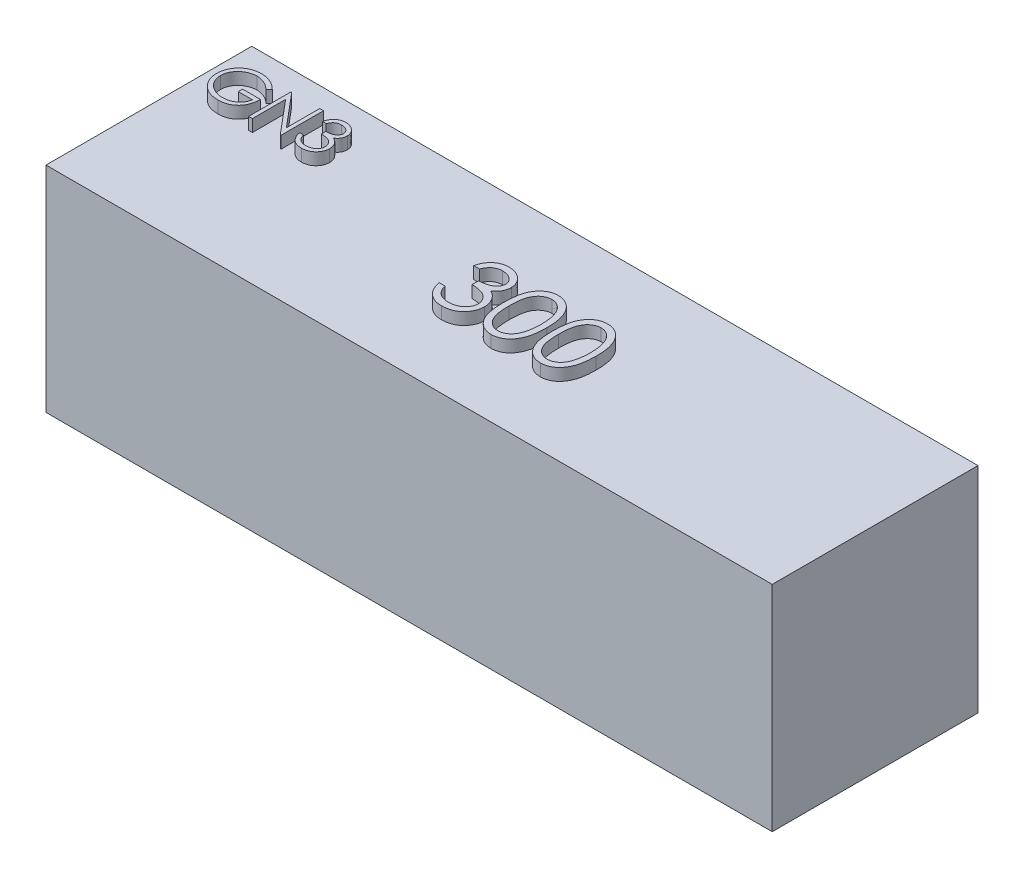
from build123d import *

# Parameters (mm, degrees)
SKETCH5_W           = 60
SKETCH5_H           = 17.7
BOSS_EXTRUDE2_DEPTH = 17
BOSS_EXTRUDE3_DEPTH = 1


with BuildPart() as part:
    # Sketch5 → Boss-Extrude2 (new body)
    with BuildSketch(Plane.XY):
        with Locations((30, 8.85)):
            Rectangle(SKETCH5_W, SKETCH5_H)
    extrude(amount=BOSS_EXTRUDE2_DEPTH)

    # Sketch6 → Boss-Extrude3 (add)
    # profile 1 of 6: a face of its own
    with BuildSketch(Plane(origin=(0, 17.7, 0), x_dir=(1, 0, 0), z_dir=(0, 1, 0))):
        with BuildLine():
            Line((4.942496515, -3.246050022), (4.673265746, -3.501258356))
            add(Edge.make_bspline(
                [(4.673265746, -3.501258356), (4.624546858, -3.455427493), (4.528270811, -3.36485863), (4.371310569, -3.247347635), (4.207546935, -3.146681534), (4.037834438, -3.064775298), (3.866375884, -2.999422537), (3.695447107, -2.952894397), (3.526801406, -2.92322186), (3.414634188, -2.91967349), (3.359363502, -2.917925022)],
                knots=[0, 0, 0, 0, 1.08915593, 2.152340314, 3.188132944, 4.216796309, 5.218260357, 6.173443236, 7.099959455, 8, 8, 8, 8], degree=3))
            add(Edge.make_bspline(
                [(3.359363502, -2.917925022), (3.325448802, -2.918338628), (3.257707362, -2.919164767), (3.157085418, -2.929708983), (3.057518781, -2.944873847), (2.959195406, -2.966815724), (2.86192412, -2.994624784), (2.766043227, -3.029410247), (2.671373873, -3.069965491), (2.578807792, -3.116827965), (2.489067288, -3.168307811), (2.404310452, -3.225356352), (2.323997053, -3.286145142), (2.249636628, -3.352196121), (2.180801441, -3.422910987), (2.11585307, -3.496974293), (2.057075774, -3.576409511), (2.003984609, -3.659755137), (1.95662299, -3.745547327), (1.914814337, -3.832960316), (1.879717249, -3.921704171), (1.851947793, -4.011890248), (1.829037139, -4.102820838), (1.812919532, -4.195125559), (1.80383281, -4.288903244), (1.80226103, -4.351700503), (1.801470874, -4.383269574)],
                knots=[0, 0, 0, 0, 1.02818874, 2.053710826, 3.065248034, 4.081641283, 5.106893873, 6.131558223, 7.173050175, 8.228653731, 9.27666206, 10.308777013, 11.325269123, 12.329503258, 13.32196095, 14.316845687, 15.314881793, 16.315733098, 17.311955233, 18.285320748, 19.252783886, 20.203351036, 21.145449891, 22.095197417, 23.042428769, 24, 24, 24, 24], degree=3))
            add(Edge.make_bspline(
                [(1.801470874, -4.383269574), (1.802226592, -4.415540391), (1.803735965, -4.479993904), (1.813396285, -4.576187977), (1.831324525, -4.670953379), (1.855292234, -4.764601512), (1.88527305, -4.85729276), (1.922645716, -4.94862527), (1.966911316, -5.038595661), (2.018147868, -5.126393278), (2.074334072, -5.211916302), (2.137277153, -5.292475824), (2.204137736, -5.369144601), (2.277351636, -5.440220365), (2.354571178, -5.507604261), (2.438103454, -5.569439783), (2.526305915, -5.626918006), (2.619313127, -5.679314525), (2.716115909, -5.726123061), (2.815372662, -5.767746957), (2.917400478, -5.802026295), (3.021663168, -5.829964399), (3.128036439, -5.852864696), (3.237060242, -5.867597176), (3.34793295, -5.878288007), (3.422671582, -5.879069677), (3.460325041, -5.879463484)],
                knots=[0, 0, 0, 0, 0.93586088, 1.869166235, 2.799637598, 3.729985548, 4.670839027, 5.622275134, 6.589130586, 7.576015415, 8.568469353, 9.55398029, 10.53834874, 11.515998671, 12.510579167, 13.508179873, 14.527009472, 15.561807829, 16.601455013, 17.643573243, 18.680854198, 19.719860599, 20.772568776, 21.833555941, 22.908541556, 24, 24, 24, 24], degree=3))
            add(Edge.make_bspline(
                [(3.460325041, -5.879463484), (3.505703388, -5.878514908), (3.594811145, -5.876652224), (3.725797588, -5.862151934), (3.851600659, -5.839505141), (3.971866862, -5.806339244), (4.086735883, -5.764035569), (4.196628824, -5.713040183), (4.300680483, -5.651397124), (4.399203656, -5.581823256), (4.489960842, -5.504308424), (4.571814966, -5.420663969), (4.643460455, -5.331295902), (4.705965154, -5.236730587), (4.757673809, -5.136185282), (4.800116604, -5.030152719), (4.832649895, -4.918585207), (4.84600487, -4.841493576), (4.852752925, -4.802540407)],
                knots=[0, 0, 0, 0, 1.13008108, 2.219097802, 3.278683437, 4.311054135, 5.322181354, 6.324827112, 7.324222904, 8.330512327, 9.32562643, 10.293043162, 11.24128371, 12.174520618, 13.111833804, 14.052305215, 15.015860969, 16, 16, 16, 16], degree=3))
            Line((4.852752925, -4.802540407), (3.686086259, -4.802540407))
            Line((3.686086259, -4.802540407), (3.686086259, -4.443566048))
            Line((3.686086259, -4.443566048), (5.166855489, -4.443566048))
            add(Edge.make_bspline(
                [(5.166855489, -4.443566048), (5.165149641, -4.510473537), (5.161810988, -4.641423579), (5.138392072, -4.832393849), (5.10057556, -5.012765543), (5.048915248, -5.182728614), (4.982039968, -5.342042207), (4.900667439, -5.490868073), (4.803495318, -5.628244754), (4.693984877, -5.755293758), (4.571084919, -5.86862297), (4.438116299, -5.968228908), (4.29485933, -6.052131523), (4.141449523, -6.120392186), (3.978389089, -6.173666181), (3.80530071, -6.211437757), (3.622419109, -6.234067721), (3.497082432, -6.2369591), (3.432981291, -6.238437843)],
                knots=[0, 0, 0, 0, 1.140356446, 2.231883559, 3.274166699, 4.278491846, 5.25512956, 6.21435461, 7.1637429, 8.11826594, 9.068280886, 10.0076534, 10.945064095, 11.891975133, 12.864533718, 13.863980011, 14.907571808, 16, 16, 16, 16], degree=3))
            add(Edge.make_bspline(
                [(3.432981291, -6.238437843), (3.393471155, -6.237868722), (3.315544434, -6.236746231), (3.200453506, -6.228768884), (3.088535886, -6.216488307), (2.979807877, -6.197943184), (2.873869535, -6.17522853), (2.77124995, -6.146141811), (2.671558208, -6.112473112), (2.574640222, -6.074177438), (2.481375675, -6.029805781), (2.391349158, -5.980496142), (2.304063033, -5.926502781), (2.220111868, -5.866891936), (2.139058246, -5.802109475), (2.061424803, -5.732025556), (1.986776925, -5.656854437), (1.940016461, -5.603475427), (1.916454848, -5.576578868)],
                knots=[0, 0, 0, 0, 1.107784379, 2.184907829, 3.233506516, 4.263428166, 5.276301166, 6.270063455, 7.25232949, 8.225834625, 9.190232166, 10.146266622, 11.1027726, 12.066435141, 13.031522626, 14.010570082, 14.99756817, 16, 16, 16, 16], degree=3))
            add(Edge.make_bspline(
                [(1.916454848, -5.576578868), (1.882268916, -5.533908215), (1.814464504, -5.449275198), (1.727186347, -5.313675254), (1.652784944, -5.173273394), (1.592417122, -5.027678765), (1.545279036, -4.877027553), (1.511472783, -4.721512261), (1.491665494, -4.560932631), (1.488811957, -4.452267366), (1.48736831, -4.39729201)],
                knots=[0, 0, 0, 0, 1.023165419, 2.029347347, 3.013907458, 3.994755782, 4.975994455, 5.96558838, 6.970761222, 8, 8, 8, 8], degree=3))
            add(Edge.make_bspline(
                [(1.48736831, -4.39729201), (1.487900548, -4.356125757), (1.48895826, -4.274316449), (1.501783776, -4.152859142), (1.520185194, -4.03355845), (1.547232249, -3.916511893), (1.581328513, -3.801641302), (1.623881999, -3.688893338), (1.673426895, -3.578201466), (1.731012392, -3.470327598), (1.795096851, -3.366703185), (1.864647071, -3.267745382), (1.940650672, -3.175256317), (2.021866471, -3.088064669), (2.109263461, -3.007265822), (2.202022885, -2.932111711), (2.300216228, -2.862501525), (2.404152408, -2.799531691), (2.512280092, -2.74296807), (2.624340094, -2.693378858), (2.740298205, -2.652395543), (2.859285682, -2.617621763), (2.982203183, -2.591906623), (3.10815872, -2.573257877), (3.237808832, -2.560497278), (3.325444861, -2.559471022), (3.369880329, -2.558950663)],
                knots=[0, 0, 0, 0, 1.008945113, 2.00506715, 2.99143336, 3.967273523, 4.948097931, 5.927297278, 6.919902385, 7.919676788, 8.923139349, 9.905703106, 10.883022732, 11.856032218, 12.825136022, 13.798837087, 14.781400844, 15.773989409, 16.776158564, 17.77167057, 18.775803737, 19.789618931, 20.80898985, 21.851988756, 22.910860228, 24, 24, 24, 24], degree=3))
            add(Edge.make_bspline(
                [(3.369880329, -2.558950663), (3.406118573, -2.559530155), (3.477974752, -2.560679219), (3.584900484, -2.568643867), (3.690173499, -2.581267748), (3.793949888, -2.598494535), (3.895876255, -2.621958225), (3.99624296, -2.65003651), (4.095195496, -2.682728333), (4.192423745, -2.721717179), (4.288581461, -2.765970804), (4.384203302, -2.815784226), (4.478962548, -2.872009231), (4.573023529, -2.934812766), (4.666979387, -3.003116184), (4.75934403, -3.078873008), (4.852346974, -3.159095764), (4.912148788, -3.216777948), (4.942496515, -3.246050022)],
                knots=[0, 0, 0, 0, 0.985871117, 1.954866573, 2.915460327, 3.869826059, 4.81536089, 5.759505086, 6.70452669, 7.649098992, 8.607881297, 9.583363685, 10.581137262, 11.603961102, 12.659522466, 13.73993555, 14.853081303, 16, 16, 16, 16], degree=3))
        make_face()
    # profile 2 of 6: a face of its own
    with BuildSketch(Plane(origin=(0, 17.7, 0), x_dir=(1, 0, 0), z_dir=(0, 1, 0))):
        Polygon((5.884804207, -6.148694253), (5.884804207, -2.648694253), (5.950709656, -2.648694253), (8.263009336, -5.403401785), (8.263009336, -2.648694253), (8.5771119, -2.648694253), (8.5771119, -6.148694253), (8.505597477, -6.148694253), (6.198906771, -3.400296817), (6.198906771, -6.148694253), align=None)
    # profile 3 of 6: a face of its own
    with BuildSketch(Plane(origin=(0, 17.7, 0), x_dir=(1, 0, 0), z_dir=(0, 1, 0))):
        with BuildLine():
            Line((9.609163182, -3.456386561), (9.295060618, -3.456386561))
            add(Edge.make_bspline(
                [(9.295060618, -3.456386561), (9.303570168, -3.421154077), (9.320205644, -3.352277452), (9.354903217, -3.253870192), (9.392702473, -3.16074667), (9.438091577, -3.074650596), (9.487600331, -2.993851694), (9.544323053, -2.920182569), (9.605642775, -2.851769604), (9.673467725, -2.791056366), (9.744596386, -2.736078637), (9.820031006, -2.68920358), (9.8982539, -2.648879427), (9.979807033, -2.615659195), (10.064933204, -2.590633671), (10.152862828, -2.572476866), (10.243826328, -2.560685752), (10.305573918, -2.559534988), (10.336927605, -2.558950663)],
                knots=[0, 0, 0, 0, 1.162005537, 2.271625781, 3.343758855, 4.383309926, 5.390229558, 6.379919256, 7.361854164, 8.333198761, 9.295911338, 10.242430842, 11.177959212, 12.116337295, 13.062827104, 14.020064771, 14.994644689, 16, 16, 16, 16], degree=3))
            add(Edge.make_bspline(
                [(10.336927605, -2.558950663), (10.382610347, -2.560329894), (10.472979358, -2.563058269), (10.605742405, -2.587972706), (10.733769224, -2.627397838), (10.855658472, -2.681871565), (10.968876904, -2.749058878), (11.069613091, -2.829023615), (11.156501602, -2.920222917), (11.22939598, -3.020955481), (11.286470979, -3.12861099), (11.328557352, -3.239411147), (11.354179033, -3.353093119), (11.35749959, -3.429850398), (11.359163182, -3.468305631)],
                knots=[0, 0, 0, 0, 1.083050992, 2.142477498, 3.193116406, 4.255571735, 5.30263384, 6.308962982, 7.297363603, 8.282367274, 9.249857812, 10.179914175, 11.08814088, 12, 12, 12, 12], degree=3))
            add(Edge.make_bspline(
                [(11.359163182, -3.468305631), (11.357999591, -3.505312426), (11.355722624, -3.57772898), (11.336388918, -3.683450478), (11.303852655, -3.783092078), (11.258782893, -3.87707324), (11.200441342, -3.96479808), (11.129768645, -4.046463971), (11.046265984, -4.122433129), (10.982987046, -4.165952602), (10.950409175, -4.188357715)],
                knots=[0, 0, 0, 0, 1.024540389, 2.004866551, 2.965041327, 3.920577974, 4.882998113, 5.874504559, 6.905732034, 8, 8, 8, 8], degree=3))
            add(Edge.make_bspline(
                [(10.950409175, -4.188357715), (10.98764093, -4.206335886), (11.061407804, -4.241955844), (11.161958334, -4.311811601), (11.253236209, -4.392467949), (11.304139928, -4.455410602), (11.329716066, -4.487035599)],
                knots=[0, 0, 0, 0, 1.015518401, 2.012035669, 3.001164323, 4, 4, 4, 4], degree=3))
            add(Edge.make_bspline(
                [(11.329716066, -4.487035599), (11.346557409, -4.510093351), (11.379964305, -4.555831267), (11.421199839, -4.629367693), (11.458608953, -4.703719183), (11.487759172, -4.780878589), (11.510333039, -4.859951602), (11.526469071, -4.941073998), (11.536493212, -5.024312021), (11.537928764, -5.080624501), (11.538650361, -5.108930631)],
                knots=[0, 0, 0, 0, 1.025084078, 2.033381695, 3.024893161, 4.013698104, 4.991890475, 5.976764909, 6.982997093, 8, 8, 8, 8], degree=3))
            add(Edge.make_bspline(
                [(11.538650361, -5.108930631), (11.536855848, -5.157940352), (11.533275266, -5.255729154), (11.501271191, -5.400203876), (11.451657951, -5.541429378), (11.381201015, -5.676504217), (11.295333506, -5.802884598), (11.193176182, -5.915960908), (11.075889773, -6.013159512), (10.945084124, -6.09436974), (10.803366996, -6.159287662), (10.651791404, -6.204345105), (10.49254135, -6.233691105), (10.383334052, -6.236837974), (10.327813021, -6.238437843)],
                knots=[0, 0, 0, 0, 0.955779014, 1.907060117, 2.875433937, 3.871313158, 4.872415639, 5.851225146, 6.836215519, 7.83643374, 8.849228613, 9.86973379, 10.916971861, 12, 12, 12, 12], degree=3))
            add(Edge.make_bspline(
                [(10.327813021, -6.238437843), (10.290393721, -6.23756963), (10.216765016, -6.235861275), (10.108521518, -6.224182674), (10.005199818, -6.202852669), (9.906660221, -6.174149364), (9.812815184, -6.137757622), (9.723951079, -6.092438924), (9.639521185, -6.039127421), (9.560322234, -5.977193834), (9.486363667, -5.907912494), (9.419610942, -5.830053484), (9.358951149, -5.74505608), (9.306008511, -5.651933024), (9.258371558, -5.551887767), (9.219190601, -5.443639268), (9.184705033, -5.328155246), (9.168671569, -5.247677506), (9.160445233, -5.206386561)],
                knots=[0, 0, 0, 0, 1.048658725, 2.063410685, 3.046034179, 4.001477787, 4.936774919, 5.862367409, 6.792675028, 7.730719943, 8.675894397, 9.627829632, 10.600096036, 11.597688215, 12.626045268, 13.701542398, 14.82072376, 16, 16, 16, 16], degree=3))
            Line((9.160445233, -5.206386561), (9.474547797, -5.206386561))
            add(Edge.make_bspline(
                [(9.474547797, -5.206386561), (9.482731089, -5.233335574), (9.498648301, -5.285753746), (9.525742599, -5.361194051), (9.556610871, -5.430352105), (9.58972543, -5.493735227), (9.624503876, -5.551967629), (9.663418801, -5.603509498), (9.703587946, -5.6506247), (9.7338673, -5.677169312), (9.748686419, -5.690160599)],
                knots=[0, 0, 0, 0, 1.198163088, 2.33053128, 3.407730985, 4.417276592, 5.372219308, 6.28897303, 7.162600585, 8, 8, 8, 8], degree=3))
            add(Edge.make_bspline(
                [(9.748686419, -5.690160599), (9.768282995, -5.705268933), (9.807415658, -5.735438965), (9.871183889, -5.773940593), (9.938248776, -5.807301619), (10.01006345, -5.832785315), (10.08507822, -5.854362975), (10.164505585, -5.868483494), (10.247644803, -5.878171666), (10.304412566, -5.879026597), (10.333421996, -5.879463484)],
                knots=[0, 0, 0, 0, 0.946170439, 1.889420265, 2.845303464, 3.807233317, 4.801018734, 5.828864929, 6.890507805, 8, 8, 8, 8], degree=3))
            add(Edge.make_bspline(
                [(10.333421996, -5.879463484), (10.366175498, -5.878847579), (10.430222145, -5.877643229), (10.523677005, -5.866567522), (10.612584452, -5.850437109), (10.695957378, -5.825524126), (10.774887885, -5.794743275), (10.848269535, -5.756094869), (10.917065641, -5.710750147), (10.980395047, -5.659210989), (11.037340554, -5.602789494), (11.087480067, -5.543776423), (11.130104729, -5.482420593), (11.164488307, -5.418382472), (11.191638857, -5.351927243), (11.210122058, -5.282868414), (11.222973573, -5.211771148), (11.224020185, -5.163442179), (11.224547797, -5.139078868)],
                knots=[0, 0, 0, 0, 1.217147791, 2.380027433, 3.494444702, 4.572153297, 5.609568379, 6.639424714, 7.649109417, 8.668170816, 9.669597737, 10.625200337, 11.543417969, 12.441394052, 13.322311151, 14.205496177, 15.095365482, 16, 16, 16, 16], degree=3))
            add(Edge.make_bspline(
                [(11.224547797, -5.139078868), (11.223017496, -5.10646753), (11.219964507, -5.041407121), (11.196655928, -4.945689547), (11.158317063, -4.853466135), (11.104644552, -4.766310345), (11.039308824, -4.685534443), (10.962943917, -4.613462961), (10.874915688, -4.553992869), (10.793895819, -4.512904213), (10.722130663, -4.484867138), (10.660715278, -4.466192173), (10.591958675, -4.450378518), (10.516692326, -4.435666246), (10.43434911, -4.423144898), (10.345018672, -4.412703082), (10.24868291, -4.404348041), (10.181991744, -4.400616946), (10.14762472, -4.398694253)],
                knots=[0, 0, 0, 0, 1.07054697, 2.135767047, 3.216561865, 4.33974944, 5.486079747, 6.621378074, 7.775625952, 8.963672916, 9.598146892, 10.304877434, 11.070270905, 11.915000392, 12.823868403, 13.805723172, 14.86925407, 16, 16, 16, 16], degree=3))
            Line((10.14762472, -4.398694253), (10.14762472, -4.039719894))
            add(Edge.make_bspline(
                [(10.14762472, -4.039719894), (10.190925886, -4.03898509), (10.275742232, -4.03754579), (10.399636537, -4.02013778), (10.518109849, -3.996057152), (10.628536591, -3.95917196), (10.729185305, -3.916331663), (10.816504907, -3.866479453), (10.889272054, -3.811064704), (10.947133126, -3.749232095), (10.990662354, -3.682917047), (11.022489152, -3.61380039), (11.041289478, -3.541276329), (11.043799145, -3.491781661), (11.045060618, -3.466903388)],
                knots=[0, 0, 0, 0, 1.321986639, 2.589447074, 3.816329219, 5.01088745, 6.139805852, 7.153945165, 8.075214402, 8.924034688, 9.728124013, 10.488707548, 11.240355623, 12, 12, 12, 12], degree=3))
            add(Edge.make_bspline(
                [(11.045060618, -3.466903388), (11.044646207, -3.448625643), (11.043821756, -3.412262935), (11.033424478, -3.359137867), (11.017800437, -3.307636921), (10.996320708, -3.257979111), (10.967570509, -3.210508837), (10.933164522, -3.164821388), (10.892196422, -3.121177609), (10.845250975, -3.080497289), (10.79483917, -3.041728052), (10.739589395, -3.008814415), (10.68116752, -2.980669353), (10.619508866, -2.957459851), (10.554413335, -2.940000563), (10.486186778, -2.927464721), (10.414699094, -2.919627067), (10.365927362, -2.918498651), (10.341134336, -2.917925022)],
                knots=[0, 0, 0, 0, 0.884392785, 1.759457502, 2.611959086, 3.489218968, 4.37281399, 5.2945488, 6.255912374, 7.266815255, 8.301784654, 9.332968512, 10.37626691, 11.440494194, 12.520033166, 13.637162961, 14.798855837, 16, 16, 16, 16], degree=3))
            add(Edge.make_bspline(
                [(10.341134336, -2.917925022), (10.301282668, -2.919316384), (10.223443091, -2.922034038), (10.111228174, -2.945837051), (10.00690884, -2.983815135), (9.927170174, -3.029148154), (9.8682876, -3.073898588), (9.826210661, -3.112980975), (9.784890151, -3.156413798), (9.747044474, -3.206872173), (9.708770497, -3.260938964), (9.673925936, -3.321362645), (9.640066244, -3.386567039), (9.619663694, -3.432662674), (9.609163182, -3.456386561)],
                knots=[0, 0, 0, 0, 1.472543308, 2.876219568, 4.221790263, 5.565193594, 6.249813518, 6.953379497, 7.687249741, 8.463570142, 9.283606569, 10.136032583, 11.040678096, 12, 12, 12, 12], degree=3))
        make_face()
    # profile 4 of 6: a face of its own
    with BuildSketch(Plane(origin=(0, 17.7, 0), x_dir=(1, 0, 0), z_dir=(0, 1, 0))):
        with BuildLine():
            Line((26.337826552, -7.526092537), (25.86293339, -7.526092537))
            add(Edge.make_bspline(
                [(25.86293339, -7.526092537), (25.87579902, -7.472824376), (25.900950275, -7.36868948), (25.953409701, -7.219907074), (26.010558575, -7.079113178), (26.079182579, -6.948944114), (26.1540351, -6.826783868), (26.239794453, -6.715403168), (26.332504033, -6.61196928), (26.435048897, -6.520176647), (26.542588659, -6.437055557), (26.65663862, -6.366184934), (26.774904186, -6.305218655), (26.898204756, -6.254992829), (27.02690742, -6.21715662), (27.159848636, -6.189705259), (27.297376785, -6.171878218), (27.390733262, -6.170138374), (27.438137049, -6.16925493)],
                knots=[0, 0, 0, 0, 1.162005537, 2.271625781, 3.343758855, 4.383309926, 5.390229558, 6.379919256, 7.361854164, 8.333198761, 9.295911338, 10.242430842, 11.177959212, 12.116337295, 13.062827104, 14.020064771, 14.994644689, 16, 16, 16, 16], degree=3))
            add(Edge.make_bspline(
                [(27.438137049, -6.16925493), (27.507205004, -6.171340194), (27.643834342, -6.175465238), (27.844559425, -6.213133493), (28.038123783, -6.272740539), (28.222408717, -6.355099626), (28.393584204, -6.456680445), (28.545887725, -6.577579511), (28.677254878, -6.71546417), (28.787464235, -6.867762213), (28.873756198, -7.030527091), (28.937386786, -7.198046376), (28.976124328, -7.36992269), (28.981144693, -7.485972386), (28.983659886, -7.544113036)],
                knots=[0, 0, 0, 0, 1.083050992, 2.142477498, 3.193116406, 4.255571735, 5.30263384, 6.308962982, 7.297363603, 8.282367274, 9.249857812, 10.179914175, 11.08814088, 12, 12, 12, 12], degree=3))
            add(Edge.make_bspline(
                [(28.983659886, -7.544113036), (28.981900647, -7.600063785), (28.978458089, -7.709550719), (28.949227368, -7.869391554), (28.900035637, -8.020040164), (28.831894449, -8.16213073), (28.743687581, -8.294762333), (28.636837194, -8.418233382), (28.510589122, -8.533091514), (28.414917394, -8.598888813), (28.365662757, -8.63276321)],
                knots=[0, 0, 0, 0, 1.024540389, 2.004866551, 2.965041327, 3.920577974, 4.882998113, 5.874504559, 6.905732034, 8, 8, 8, 8], degree=3))
            add(Edge.make_bspline(
                [(28.365662757, -8.63276321), (28.421953624, -8.659944493), (28.533482113, -8.713798476), (28.685504937, -8.819413729), (28.823508391, -8.941358444), (28.900469966, -9.036521741), (28.939138652, -9.084335726)],
                knots=[0, 0, 0, 0, 1.015518401, 2.012035669, 3.001164323, 4, 4, 4, 4], degree=3))
            add(Edge.make_bspline(
                [(28.939138652, -9.084335726), (28.964601157, -9.11919685), (29.015109203, -9.188348224), (29.077453403, -9.299528296), (29.134012421, -9.411940667), (29.178084776, -9.52859834), (29.212214313, -9.648149206), (29.236610457, -9.770798543), (29.251766003, -9.896646506), (29.253936421, -9.981785613), (29.255027407, -10.024581786)],
                knots=[0, 0, 0, 0, 1.025084078, 2.033381695, 3.024893161, 4.013698104, 4.991890475, 5.976764909, 6.982997093, 8, 8, 8, 8], degree=3))
            add(Edge.make_bspline(
                [(29.255027407, -10.024581786), (29.252314274, -10.098679817), (29.246900775, -10.246527172), (29.198513662, -10.464959192), (29.123503167, -10.678478701), (29.01697899, -10.882698994), (28.887155495, -11.073774093), (28.73270335, -11.244734704), (28.555377471, -11.391689736), (28.357611787, -11.514471867), (28.143348986, -11.612621583), (27.914181126, -11.680744145), (27.673410212, -11.725112502), (27.508299178, -11.729870268), (27.424356667, -11.732289118)],
                knots=[0, 0, 0, 0, 0.955779014, 1.907060117, 2.875433937, 3.871313158, 4.872415639, 5.851225146, 6.836215519, 7.83643374, 8.849228613, 9.86973379, 10.916971861, 12, 12, 12, 12], degree=3))
            add(Edge.make_bspline(
                [(27.424356667, -11.732289118), (27.367782249, -11.730976462), (27.256462659, -11.728393593), (27.092808799, -11.71073666), (26.936596229, -11.678487724), (26.787613742, -11.63509106), (26.645728985, -11.580070212), (26.511374921, -11.511552656), (26.383724963, -11.430950743), (26.263983691, -11.337313056), (26.152165381, -11.232566269), (26.051241619, -11.114850861), (25.959529789, -10.986342881), (25.879485562, -10.845549689), (25.807463026, -10.694290788), (25.748225151, -10.530629368), (25.696086256, -10.356028525), (25.671845185, -10.234353846), (25.659407749, -10.17192587)],
                knots=[0, 0, 0, 0, 1.048658725, 2.063410685, 3.046034179, 4.001477787, 4.936774919, 5.862367409, 6.792675028, 7.730719943, 8.675894397, 9.627829632, 10.600096036, 11.597688215, 12.626045268, 13.701542398, 14.82072376, 16, 16, 16, 16], degree=3))
            Line((25.659407749, -10.17192587), (26.134300911, -10.17192587))
            add(Edge.make_bspline(
                [(26.134300911, -10.17192587), (26.146673269, -10.212670211), (26.170738578, -10.291921495), (26.211702577, -10.405980052), (26.258372464, -10.510540442), (26.308438523, -10.606369686), (26.361020221, -10.694411533), (26.419855882, -10.77233793), (26.480587804, -10.843571628), (26.526367302, -10.883704554), (26.548772399, -10.903346142)],
                knots=[0, 0, 0, 0, 1.198163088, 2.33053128, 3.407730985, 4.417276592, 5.372219308, 6.28897303, 7.162600585, 8, 8, 8, 8], degree=3))
            add(Edge.make_bspline(
                [(26.548772399, -10.903346142), (26.578400556, -10.926188504), (26.637565416, -10.971802719), (26.733976908, -11.030013514), (26.835372629, -11.080452208), (26.943949577, -11.118981128), (27.057364765, -11.151604497), (27.177451377, -11.172953377), (27.303149955, -11.187600969), (27.388977407, -11.188893544), (27.432836902, -11.189554075)],
                knots=[0, 0, 0, 0, 0.946170439, 1.889420265, 2.845303464, 3.807233317, 4.801018734, 5.828864929, 6.890507805, 8, 8, 8, 8], degree=3))
            add(Edge.make_bspline(
                [(27.432836902, -11.189554075), (27.482357079, -11.188622885), (27.579189509, -11.186802023), (27.720484356, -11.170056609), (27.85490395, -11.14566896), (27.980955873, -11.108002903), (28.100291283, -11.061465187), (28.211237348, -11.003032479), (28.315250509, -10.934475578), (28.410998539, -10.856553279), (28.497094723, -10.771249352), (28.572900891, -10.682027209), (28.63734532, -10.589263038), (28.689330016, -10.492443498), (28.730379062, -10.391969521), (28.758323901, -10.287559148), (28.777754168, -10.180066852), (28.779336546, -10.106998054), (28.780134245, -10.070163049)],
                knots=[0, 0, 0, 0, 1.217147791, 2.380027433, 3.494444702, 4.572153297, 5.609568379, 6.639424714, 7.649109417, 8.668170816, 9.669597737, 10.625200337, 11.543417969, 12.441394052, 13.322311151, 14.205496177, 15.095365482, 16, 16, 16, 16], degree=3))
            add(Edge.make_bspline(
                [(28.780134245, -10.070163049), (28.777820575, -10.020857811), (28.773204747, -9.92249267), (28.737964394, -9.777776813), (28.679999683, -9.638343797), (28.598851958, -9.506572543), (28.500070558, -9.384447073), (28.384614092, -9.275481855), (28.251523794, -9.185568741), (28.129029469, -9.123446606), (28.020527387, -9.081057219), (27.927673175, -9.052822451), (27.823719739, -9.02891371), (27.709924187, -9.006670156), (27.585429086, -8.98773907), (27.450369972, -8.971952039), (27.304719475, -8.959320013), (27.203888784, -8.953678952), (27.151929117, -8.950772024)],
                knots=[0, 0, 0, 0, 1.07054697, 2.135767047, 3.216561865, 4.33974944, 5.486079747, 6.621378074, 7.775625952, 8.963672916, 9.598146892, 10.304877434, 11.070270905, 11.915000392, 12.823868403, 13.805723172, 14.86925407, 16, 16, 16, 16], degree=3))
            Line((27.151929117, -8.950772024), (27.151929117, -8.408036981))
            add(Edge.make_bspline(
                [(27.151929117, -8.408036981), (27.217396355, -8.406926028), (27.345630593, -8.404749943), (27.532946983, -8.378430689), (27.712067348, -8.342023073), (27.879022065, -8.286256175), (28.031193334, -8.221485727), (28.163212256, -8.146113934), (28.273229252, -8.06233211), (28.360709682, -7.968847094), (28.42652173, -7.868585058), (28.474640816, -7.764087254), (28.503065119, -7.654437781), (28.506859497, -7.579606557), (28.508766723, -7.541992977)],
                knots=[0, 0, 0, 0, 1.321986639, 2.589447074, 3.816329219, 5.01088745, 6.139805852, 7.153945165, 8.075214402, 8.924034688, 9.728124013, 10.488707548, 11.240355623, 12, 12, 12, 12], degree=3))
            add(Edge.make_bspline(
                [(28.508766723, -7.541992977), (28.508140173, -7.514358767), (28.506893682, -7.459381817), (28.491173988, -7.379061773), (28.467551926, -7.301197248), (28.435076621, -7.226119368), (28.391609059, -7.154348835), (28.339590484, -7.085273763), (28.277650618, -7.019288526), (28.206673573, -6.957783757), (28.130455725, -6.899168363), (28.046923327, -6.849406078), (27.958595017, -6.806853425), (27.865373003, -6.771762868), (27.766954761, -6.745366087), (27.663802703, -6.726413089), (27.555720134, -6.714563301), (27.48198192, -6.712857244), (27.444497225, -6.711989972)],
                knots=[0, 0, 0, 0, 0.884392785, 1.759457502, 2.611959086, 3.489218968, 4.37281399, 5.2945488, 6.255912374, 7.266815255, 8.301784654, 9.332968512, 10.37626691, 11.440494194, 12.520033166, 13.637162961, 14.798855837, 16, 16, 16, 16], degree=3))
            add(Edge.make_bspline(
                [(27.444497225, -6.711989972), (27.384245299, -6.714093579), (27.266559273, -6.718202413), (27.096901005, -6.754190302), (26.939180108, -6.811609547), (26.818622838, -6.880148755), (26.729597994, -6.947807149), (26.66598167, -7.006895995), (26.603508994, -7.072562288), (26.546289935, -7.148850546), (26.488423327, -7.230594384), (26.435741669, -7.321949236), (26.384549039, -7.42053207), (26.353702327, -7.490224279), (26.337826552, -7.526092537)],
                knots=[0, 0, 0, 0, 1.472543308, 2.876219568, 4.221790263, 5.565193594, 6.249813518, 6.953379497, 7.687249741, 8.463570142, 9.283606569, 10.136032583, 11.040678096, 12, 12, 12, 12], degree=3))
        make_face()
    # profile 5 of 6: a face of its own
    with BuildSketch(Plane(origin=(0, 17.7, 0), x_dir=(1, 0, 0), z_dir=(0, 1, 0))):
        with BuildLine():
            add(Edge.make_bspline(
                [(29.72992057, -8.952892082), (29.730416502, -8.868078175), (29.731379857, -8.703325937), (29.742096875, -8.46325868), (29.759900071, -8.23804491), (29.784298242, -8.027673846), (29.813988997, -7.832091178), (29.853624316, -7.651819581), (29.898698435, -7.4860247), (29.950938442, -7.334165888), (30.009884266, -7.194197218), (30.074040827, -7.063530545), (30.145954266, -6.942363576), (30.221514599, -6.828762392), (30.303780469, -6.724586568), (30.390410783, -6.628364924), (30.484786715, -6.542321289), (30.583700073, -6.463934618), (30.688046394, -6.395219345), (30.794851377, -6.334693657), (30.904850168, -6.282986715), (31.018343087, -6.242330937), (31.13431005, -6.208750252), (31.253156448, -6.185786009), (31.375078511, -6.171336874), (31.457373656, -6.169955495), (31.499109605, -6.16925493)],
                knots=[0, 0, 0, 0, 1.646270934, 3.197905019, 4.663502075, 6.030701355, 7.308322542, 8.50163776, 9.611534131, 10.641858119, 11.616356847, 12.558055219, 13.465016945, 14.349605745, 15.204443733, 16.039544428, 16.859896111, 17.680448484, 18.487036065, 19.28249412, 20.06191084, 20.843045899, 21.620316918, 22.403196591, 23.190181807, 24, 24, 24, 24], degree=3))
            add(Edge.make_bspline(
                [(31.499109605, -6.16925493), (31.541194198, -6.16999246), (31.624887211, -6.171459175), (31.748622064, -6.185556088), (31.869498369, -6.208946953), (31.987000793, -6.242089379), (32.102094522, -6.283206652), (32.213879329, -6.334743126), (32.32304956, -6.394733795), (32.427870352, -6.465224657), (32.529492449, -6.543816908), (32.625419726, -6.632660467), (32.715660915, -6.730858257), (32.801348579, -6.837359646), (32.880051685, -6.954207334), (32.955001993, -7.079369024), (33.022088285, -7.215033545), (33.086699044, -7.358937348), (33.142468655, -7.515062165), (33.19276405, -7.682527934), (33.23340249, -7.863312717), (33.267252938, -8.056467992), (33.293476769, -8.262703116), (33.31257612, -8.481575998), (33.322665189, -8.713230636), (33.324565202, -8.871614527), (33.325540228, -8.952892082)],
                knots=[0, 0, 0, 0, 0.810914788, 1.612654377, 2.396697861, 3.181598691, 3.963628158, 4.749916497, 5.551656086, 6.361998678, 7.18212741, 8.025565596, 8.878627764, 9.750805457, 10.657531673, 11.591944965, 12.560506719, 13.57287815, 14.630710178, 15.753379473, 16.941251878, 18.199788006, 19.531962791, 20.947069417, 22.433333509, 24, 24, 24, 24], degree=3))
            add(Edge.make_bspline(
                [(33.325540228, -8.952892082), (33.324555094, -9.033815134), (33.322635601, -9.191490399), (33.312689223, -9.422102707), (33.293097007, -9.639814034), (33.268589048, -9.845146519), (33.23464533, -10.037245538), (33.192908948, -10.216775835), (33.146568579, -10.384512706), (33.089365974, -10.539082004), (33.026756923, -10.682639966), (32.958637758, -10.81669625), (32.885658378, -10.942435764), (32.806149204, -11.058852048), (32.721401781, -11.166769779), (32.629602267, -11.264284042), (32.533338407, -11.353744463), (32.431417254, -11.433348709), (32.324961695, -11.503024545), (32.216166423, -11.565335961), (32.10310107, -11.615580631), (31.988327915, -11.658722896), (31.870205267, -11.691683103), (31.748880366, -11.714473337), (31.624970343, -11.730456965), (31.541208453, -11.731676285), (31.499109605, -11.732289118)],
                knots=[0, 0, 0, 0, 1.561518951, 3.042555995, 4.452378317, 5.7783523, 7.031515105, 8.214008947, 9.334062868, 10.386615937, 11.391082383, 12.354592575, 13.286541444, 14.194233754, 15.072674879, 15.931287219, 16.775624067, 17.606195743, 18.42308326, 19.229000347, 20.022332153, 20.807536673, 21.593273796, 22.3848459, 23.188221202, 24, 24, 24, 24], degree=3))
            add(Edge.make_bspline(
                [(31.499109605, -11.732289118), (31.457374814, -11.731584033), (31.375081951, -11.730193743), (31.253143165, -11.715809887), (31.134787566, -11.692684543), (31.019431117, -11.660304677), (30.906481981, -11.620670341), (30.797479262, -11.569033224), (30.691210978, -11.509563858), (30.587960649, -11.441837447), (30.489668454, -11.36424395), (30.395781276, -11.278421751), (30.308657736, -11.182229213), (30.227568091, -11.07718521), (30.150500124, -10.964256141), (30.079607858, -10.841900149), (30.014035257, -10.710602392), (29.954098075, -10.569514599), (29.900956643, -10.416577982), (29.854015465, -10.250042914), (29.816952394, -10.068439512), (29.785228164, -9.87322635), (29.759640108, -9.663564574), (29.742171069, -9.439340362), (29.731374081, -9.200693439), (29.730413915, -9.036999852), (29.72992057, -8.952892082)],
                knots=[0, 0, 0, 0, 0.810891512, 1.598919785, 2.382837074, 3.152667961, 3.926044502, 4.706494248, 5.493654104, 6.291793342, 7.103789334, 7.925228297, 8.761435821, 9.622817696, 10.50288917, 11.416980706, 12.369136599, 13.353924996, 14.394355917, 15.514179734, 16.714354668, 17.994756427, 19.357759367, 20.818452758, 22.365282078, 24, 24, 24, 24], degree=3))
        make_face()
        with BuildLine():
            add(Edge.make_bspline(
                [(30.204813732, -8.950772024), (30.204994324, -9.021451604), (30.205344819, -9.158626791), (30.214501218, -9.357961245), (30.226974783, -9.543880671), (30.243063411, -9.716621136), (30.266955964, -9.875597941), (30.293726941, -10.021904486), (30.3263056, -10.154766499), (30.364851639, -10.275095689), (30.408755988, -10.384934162), (30.456692234, -10.487140761), (30.508188803, -10.582922855), (30.565821328, -10.671420096), (30.62858815, -10.752921082), (30.69507153, -10.828868341), (30.767752699, -10.89659711), (30.868300024, -10.977826998), (31.001039932, -11.061766641), (31.168287525, -11.134861324), (31.340143397, -11.180796705), (31.45678874, -11.186638336), (31.515010046, -11.189554075)],
                knots=[0, 0, 0, 0, 1.459021318, 2.831673884, 4.118529203, 5.306027144, 6.411944654, 7.436330062, 8.375795394, 9.233974572, 10.042671642, 10.816086306, 11.563610507, 12.285937304, 12.993564865, 13.685989202, 14.367179055, 15.041617293, 16.353048772, 17.594441528, 18.799311195, 20, 20, 20, 20], degree=3))
            add(Edge.make_bspline(
                [(31.515010046, -11.189554075), (31.573607954, -11.187138383), (31.690682788, -11.182311985), (31.861730312, -11.135747228), (32.02778322, -11.06548971), (32.157915797, -10.982414314), (32.256919166, -10.903298864), (32.327853187, -10.835845765), (32.392958903, -10.760317251), (32.45470823, -10.678826649), (32.511342785, -10.58981706), (32.562843005, -10.493716499), (32.609838066, -10.3902581), (32.636612457, -10.318034804), (32.650301512, -10.281108896)],
                knots=[0, 0, 0, 0, 1.353760809, 2.704726607, 4.075137775, 5.516104923, 6.260822281, 7.007110065, 7.778089737, 8.566572457, 9.372053459, 10.217411131, 11.088608312, 12, 12, 12, 12], degree=3))
            add(Edge.make_bspline(
                [(32.650301512, -10.281108896), (32.66625478, -10.233892504), (32.698646756, -10.13802298), (32.740393129, -9.989306506), (32.773270102, -9.833273755), (32.802848047, -9.67085721), (32.823036596, -9.500859091), (32.839286266, -9.323805391), (32.848857662, -9.139562617), (32.850044131, -9.014384476), (32.850647065, -8.950772024)],
                knots=[0, 0, 0, 0, 0.884706709, 1.796334032, 2.740027952, 3.714592787, 4.726048262, 5.777819803, 6.87074269, 8, 8, 8, 8], degree=3))
            add(Edge.make_bspline(
                [(32.850647065, -8.950772024), (32.849815232, -8.88716986), (32.848187987, -8.762750433), (32.841968029, -8.580538422), (32.825906196, -8.407474069), (32.808067052, -8.242811806), (32.781764111, -8.087463135), (32.753404094, -7.940127554), (32.715302261, -7.802630362), (32.674602125, -7.672818851), (32.628019741, -7.552167862), (32.576742381, -7.440114875), (32.521978531, -7.336118922), (32.462496811, -7.240465332), (32.399003337, -7.152725654), (32.329822281, -7.074659065), (32.257697812, -7.00384603), (32.156676591, -6.923015717), (32.024423796, -6.840599225), (31.859859543, -6.764753374), (31.688605117, -6.721197979), (31.572833347, -6.715057095), (31.515010046, -6.711989972)],
                knots=[0, 0, 0, 0, 1.31362396, 2.569729283, 3.763502607, 4.902122613, 5.988968491, 7.01645872, 7.998833611, 8.933434873, 9.825090667, 10.667526885, 11.477055099, 12.250526234, 12.991942729, 13.710640831, 14.402115721, 15.076753259, 16.378508321, 17.609869233, 18.806226677, 20, 20, 20, 20], degree=3))
            add(Edge.make_bspline(
                [(31.515010046, -6.711989972), (31.456483317, -6.715061326), (31.339323239, -6.721209629), (31.166288831, -6.764591096), (31.000426299, -6.840205937), (30.868523231, -6.923288691), (30.767431553, -7.002419233), (30.696247005, -7.071039229), (30.629502197, -7.146099638), (30.568016507, -7.228350152), (30.510429139, -7.316744219), (30.457541179, -7.411977232), (30.409889979, -7.514531795), (30.36591693, -7.624320929), (30.32725331, -7.744639738), (30.295361246, -7.877338098), (30.265898678, -8.023179291), (30.245041545, -8.183017119), (30.226499914, -8.355800851), (30.214584067, -8.542184415), (30.20531419, -8.741853181), (30.204983892, -8.879737623), (30.204813732, -8.950772024)],
                knots=[0, 0, 0, 0, 1.207732386, 2.417664972, 3.655092373, 4.956220595, 5.625982001, 6.301752483, 6.994047911, 7.697131622, 8.419323945, 9.170223765, 9.943494443, 10.752040957, 11.610060368, 12.549350801, 13.567764191, 14.679664412, 15.874934091, 17.154273443, 18.533957287, 20, 20, 20, 20], degree=3))
        make_face(mode=Mode.SUBTRACT)
    # profile 6 of 6: a face of its own
    with BuildSketch(Plane(origin=(0, 17.7, 0), x_dir=(1, 0, 0), z_dir=(0, 1, 0))):
        with BuildLine():
            add(Edge.make_bspline(
                [(33.80043339, -8.952892082), (33.800929322, -8.868078175), (33.801892678, -8.703325937), (33.812609695, -8.46325868), (33.830412891, -8.23804491), (33.854811062, -8.027673846), (33.884501818, -7.832091178), (33.924137137, -7.651819581), (33.969211255, -7.4860247), (34.021451262, -7.334165888), (34.080397086, -7.194197218), (34.144553647, -7.063530545), (34.216467086, -6.942363576), (34.292027419, -6.828762392), (34.374293289, -6.724586568), (34.460923603, -6.628364924), (34.555299535, -6.542321289), (34.654212893, -6.463934618), (34.758559214, -6.395219345), (34.865364198, -6.334693657), (34.975362989, -6.282986715), (35.088855908, -6.242330937), (35.204822871, -6.208750252), (35.323669269, -6.185786009), (35.445591331, -6.171336874), (35.527886477, -6.169955495), (35.569622426, -6.16925493)],
                knots=[0, 0, 0, 0, 1.646270934, 3.197905019, 4.663502075, 6.030701355, 7.308322542, 8.50163776, 9.611534131, 10.641858119, 11.616356847, 12.558055219, 13.465016945, 14.349605745, 15.204443733, 16.039544428, 16.859896111, 17.680448484, 18.487036065, 19.28249412, 20.06191084, 20.843045899, 21.620316918, 22.403196591, 23.190181807, 24, 24, 24, 24], degree=3))
            add(Edge.make_bspline(
                [(35.569622426, -6.16925493), (35.611707018, -6.16999246), (35.695400032, -6.171459175), (35.819134885, -6.185556088), (35.940011189, -6.208946953), (36.057513613, -6.242089379), (36.172607343, -6.283206652), (36.28439215, -6.334743126), (36.39356238, -6.394733795), (36.498383172, -6.465224657), (36.600005269, -6.543816908), (36.695932546, -6.632660467), (36.786173736, -6.730858257), (36.8718614, -6.837359646), (36.950564505, -6.954207334), (37.025514813, -7.079369024), (37.092601106, -7.215033545), (37.157211865, -7.358937348), (37.212981476, -7.515062165), (37.26327687, -7.682527934), (37.303915311, -7.863312717), (37.337765758, -8.056467992), (37.363989589, -8.262703116), (37.383088941, -8.481575998), (37.39317801, -8.713230636), (37.395078022, -8.871614527), (37.396053048, -8.952892082)],
                knots=[0, 0, 0, 0, 0.810914788, 1.612654377, 2.396697861, 3.181598691, 3.963628158, 4.749916497, 5.551656086, 6.361998678, 7.18212741, 8.025565596, 8.878627764, 9.750805457, 10.657531673, 11.591944965, 12.560506719, 13.57287815, 14.630710178, 15.753379473, 16.941251878, 18.199788006, 19.531962791, 20.947069417, 22.433333509, 24, 24, 24, 24], degree=3))
            add(Edge.make_bspline(
                [(37.396053048, -8.952892082), (37.395067914, -9.033815134), (37.393148421, -9.191490399), (37.383202043, -9.422102707), (37.363609827, -9.639814034), (37.339101869, -9.845146519), (37.305158151, -10.037245538), (37.263421768, -10.216775835), (37.217081399, -10.384512706), (37.159878794, -10.539082004), (37.097269744, -10.682639966), (37.029150578, -10.81669625), (36.956171198, -10.942435764), (36.876662024, -11.058852048), (36.791914602, -11.166769779), (36.700115088, -11.264284042), (36.603851227, -11.353744463), (36.501930075, -11.433348709), (36.395474515, -11.503024545), (36.286679244, -11.565335961), (36.173613891, -11.615580631), (36.058840736, -11.658722896), (35.940718087, -11.691683103), (35.819393187, -11.714473337), (35.695483164, -11.730456965), (35.611721273, -11.731676285), (35.569622426, -11.732289118)],
                knots=[0, 0, 0, 0, 1.561518951, 3.042555995, 4.452378317, 5.7783523, 7.031515105, 8.214008947, 9.334062868, 10.386615937, 11.391082383, 12.354592575, 13.286541444, 14.194233754, 15.072674879, 15.931287219, 16.775624067, 17.606195743, 18.42308326, 19.229000347, 20.022332153, 20.807536673, 21.593273796, 22.3848459, 23.188221202, 24, 24, 24, 24], degree=3))
            add(Edge.make_bspline(
                [(35.569622426, -11.732289118), (35.527887634, -11.731584033), (35.445594772, -11.730193743), (35.323655986, -11.715809887), (35.205300387, -11.692684543), (35.089943937, -11.660304677), (34.976994801, -11.620670341), (34.867992082, -11.569033224), (34.761723799, -11.509563858), (34.65847347, -11.441837447), (34.560181274, -11.36424395), (34.466294097, -11.278421751), (34.379170556, -11.182229213), (34.298080912, -11.07718521), (34.221012945, -10.964256141), (34.150120678, -10.841900149), (34.084548077, -10.710602392), (34.024610895, -10.569514599), (33.971469463, -10.416577982), (33.924528286, -10.250042914), (33.887465214, -10.068439512), (33.855740984, -9.87322635), (33.830152929, -9.663564574), (33.812683889, -9.439340362), (33.801886901, -9.200693439), (33.800926735, -9.036999852), (33.80043339, -8.952892082)],
                knots=[0, 0, 0, 0, 0.810891512, 1.598919785, 2.382837074, 3.152667961, 3.926044502, 4.706494248, 5.493654104, 6.291793342, 7.103789334, 7.925228297, 8.761435821, 9.622817696, 10.50288917, 11.416980706, 12.369136599, 13.353924996, 14.394355917, 15.514179734, 16.714354668, 17.994756427, 19.357759367, 20.818452758, 22.365282078, 24, 24, 24, 24], degree=3))
        make_face()
        with BuildLine():
            add(Edge.make_bspline(
                [(34.275326552, -8.950772024), (34.275507145, -9.021451604), (34.27585764, -9.158626791), (34.285014038, -9.357961245), (34.297487603, -9.543880671), (34.313576231, -9.716621136), (34.337468784, -9.875597941), (34.364239761, -10.021904486), (34.39681842, -10.154766499), (34.435364459, -10.275095689), (34.479268808, -10.384934162), (34.527205054, -10.487140761), (34.578701624, -10.582922855), (34.636334149, -10.671420096), (34.699100971, -10.752921082), (34.765584351, -10.828868341), (34.83826552, -10.89659711), (34.938812845, -10.977826998), (35.071552752, -11.061766641), (35.238800345, -11.134861324), (35.410656218, -11.180796705), (35.52730156, -11.186638336), (35.585522867, -11.189554075)],
                knots=[0, 0, 0, 0, 1.459021318, 2.831673884, 4.118529203, 5.306027144, 6.411944654, 7.436330062, 8.375795394, 9.233974572, 10.042671642, 10.816086306, 11.563610507, 12.285937304, 12.993564865, 13.685989202, 14.367179055, 15.041617293, 16.353048772, 17.594441528, 18.799311195, 20, 20, 20, 20], degree=3))
            add(Edge.make_bspline(
                [(35.585522867, -11.189554075), (35.644120775, -11.187138383), (35.761195609, -11.182311985), (35.932243132, -11.135747228), (36.098296041, -11.06548971), (36.228428617, -10.982414314), (36.327431986, -10.903298864), (36.398366007, -10.835845765), (36.463471723, -10.760317251), (36.525221051, -10.678826649), (36.581855606, -10.58981706), (36.633355826, -10.493716499), (36.680350887, -10.3902581), (36.707125278, -10.318034804), (36.720814333, -10.281108896)],
                knots=[0, 0, 0, 0, 1.353760809, 2.704726607, 4.075137775, 5.516104923, 6.260822281, 7.007110065, 7.778089737, 8.566572457, 9.372053459, 10.217411131, 11.088608312, 12, 12, 12, 12], degree=3))
            add(Edge.make_bspline(
                [(36.720814333, -10.281108896), (36.736767601, -10.233892504), (36.769159577, -10.13802298), (36.81090595, -9.989306506), (36.843782922, -9.833273755), (36.873360868, -9.67085721), (36.893549417, -9.500859091), (36.909799087, -9.323805391), (36.919370483, -9.139562617), (36.920556951, -9.014384476), (36.921159886, -8.950772024)],
                knots=[0, 0, 0, 0, 0.884706709, 1.796334032, 2.740027952, 3.714592787, 4.726048262, 5.777819803, 6.87074269, 8, 8, 8, 8], degree=3))
            add(Edge.make_bspline(
                [(36.921159886, -8.950772024), (36.920328052, -8.88716986), (36.918700807, -8.762750433), (36.91248085, -8.580538422), (36.896419017, -8.407474069), (36.878579873, -8.242811806), (36.852276932, -8.087463135), (36.823916914, -7.940127554), (36.785815081, -7.802630362), (36.745114945, -7.672818851), (36.698532561, -7.552167862), (36.647255201, -7.440114875), (36.592491352, -7.336118922), (36.533009631, -7.240465332), (36.469516158, -7.152725654), (36.400335101, -7.074659065), (36.328210633, -7.00384603), (36.227189412, -6.923015717), (36.094936616, -6.840599225), (35.930372364, -6.764753374), (35.759117937, -6.721197979), (35.643346167, -6.715057095), (35.585522867, -6.711989972)],
                knots=[0, 0, 0, 0, 1.31362396, 2.569729283, 3.763502607, 4.902122613, 5.988968491, 7.01645872, 7.998833611, 8.933434873, 9.825090667, 10.667526885, 11.477055099, 12.250526234, 12.991942729, 13.710640831, 14.402115721, 15.076753259, 16.378508321, 17.609869233, 18.806226677, 20, 20, 20, 20], degree=3))
            add(Edge.make_bspline(
                [(35.585522867, -6.711989972), (35.526996138, -6.715061326), (35.409836059, -6.721209629), (35.236801652, -6.764591096), (35.07093912, -6.840205937), (34.939036051, -6.923288691), (34.837944374, -7.002419233), (34.766759825, -7.071039229), (34.700015018, -7.146099638), (34.638529328, -7.228350152), (34.580941959, -7.316744219), (34.528054, -7.411977232), (34.480402799, -7.514531795), (34.43642975, -7.624320929), (34.39776613, -7.744639738), (34.365874067, -7.877338098), (34.336411498, -8.023179291), (34.315554366, -8.183017119), (34.297012735, -8.355800851), (34.285096887, -8.542184415), (34.27582701, -8.741853181), (34.275496713, -8.879737623), (34.275326552, -8.950772024)],
                knots=[0, 0, 0, 0, 1.207732386, 2.417664972, 3.655092373, 4.956220595, 5.625982001, 6.301752483, 6.994047911, 7.697131622, 8.419323945, 9.170223765, 9.943494443, 10.752040957, 11.610060368, 12.549350801, 13.567764191, 14.679664412, 15.874934091, 17.154273443, 18.533957287, 20, 20, 20, 20], degree=3))
        make_face(mode=Mode.SUBTRACT)
    extrude(amount=BOSS_EXTRUDE3_DEPTH)


solid = part.part
